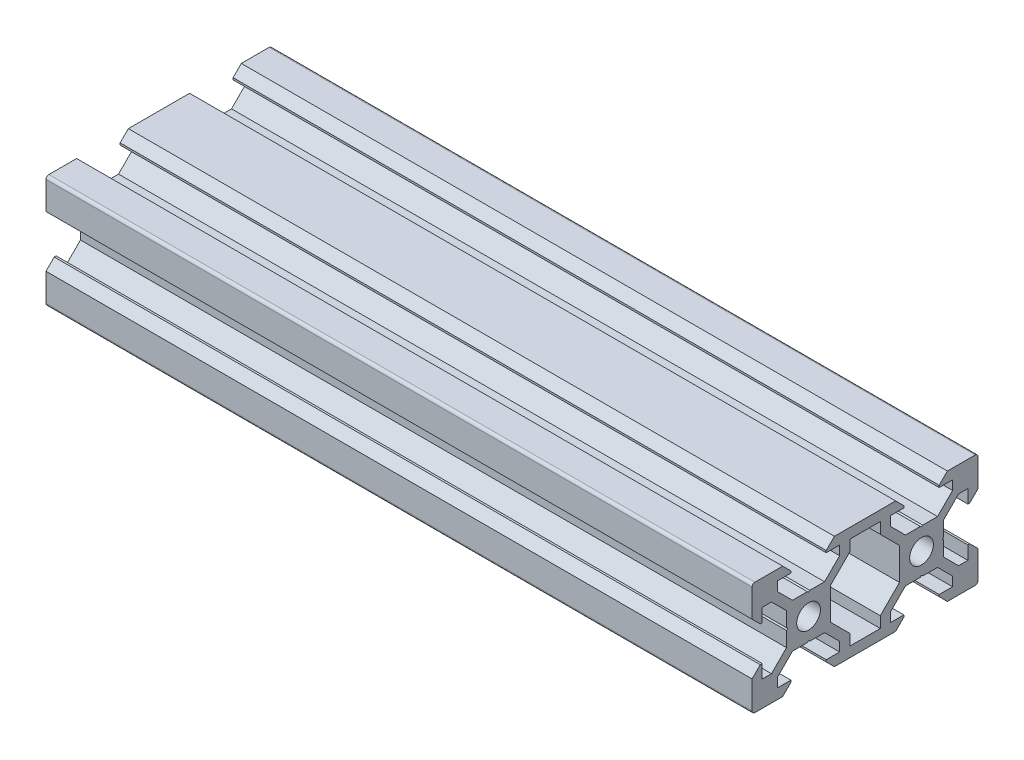
from build123d import *

# Parameters (mm, degrees)
PROFILE_SKETCH_R      = 2.1
PROFILE_EXTRUDE_DEPTH = 125


with BuildPart() as part:
    # Profile Sketch → Profile Extrude (new body)
    with BuildSketch(Plane(origin=(0, 0, 0), x_dir=(0, 0, -1), z_dir=(1, 0, 0))):
        with BuildLine():
            Line((6.875, 8.545), (5.42, 10))
            Line((5.42, 10), (-5.42, 10))
            Line((-5.42, 10), (-6.875, 8.545))
            Line((-6.875, 8.545), (-6.875, 8.2))
            Line((-6.875, 8.2), (-4.5, 8.2))
            Line((-4.5, 8.2), (-4.5, 6.56))
            Line((-4.5, 6.56), (-7.16, 3.9))
            Line((-7.16, 3.9), (-9.79, 3.9))
            Line((-9.79, 3.9), (-10, 3.69))
            Line((-10, 3.69), (-10.21, 3.9))
            Line((-10.21, 3.9), (-12.84, 3.9))
            Line((-12.84, 3.9), (-15.5, 6.56))
            Line((-15.5, 6.56), (-15.5, 8.2))
            Line((-15.5, 8.2), (-13.125, 8.2))
            Line((-13.125, 8.2), (-13.125, 8.545))
            Line((-13.125, 8.545), (-14.58, 10))
            Line((-14.58, 10), (-19.5, 10))
            ThreePointArc((-19.5, 10), (-19.853553391, 9.853553391), (-20, 9.5))
            Line((-20, 9.5), (-20, 4.58))
            Line((-20, 4.58), (-18.545, 3.125))
            Line((-18.545, 3.125), (-18.2, 3.125))
            Line((-18.2, 3.125), (-18.2, 5.5))
            Line((-18.2, 5.5), (-16.56, 5.5))
            Line((-16.56, 5.5), (-13.9, 2.838679656))
            Line((-13.9, 2.838679656), (-13.9, 0.21))
            Line((-13.9, 0.21), (-13.69, 0))
            Line((-13.69, 0), (-13.9, -0.21))
            Line((-13.9, -0.21), (-13.9, -2.838679656))
            Line((-13.9, -2.838679656), (-16.56, -5.5))
            Line((-16.56, -5.5), (-18.2, -5.5))
            Line((-18.2, -5.5), (-18.2, -3.125))
            Line((-18.2, -3.125), (-18.545, -3.125))
            Line((-18.545, -3.125), (-20, -4.58))
            Line((-20, -4.58), (-20, -9.5))
            ThreePointArc((-20, -9.5), (-19.853553391, -9.853553391), (-19.5, -10))
            Line((-19.5, -10), (-14.58, -10))
            Line((-14.58, -10), (-13.125, -8.545))
            Line((-13.125, -8.545), (-13.125, -8.2))
            Line((-13.125, -8.2), (-15.5, -8.2))
            Line((-15.5, -8.2), (-15.5, -6.56))
            Line((-15.5, -6.56), (-12.84, -3.9))
            Line((-12.84, -3.9), (-10.21, -3.9))
            Line((-10.21, -3.9), (-10, -3.69))
            Line((-10, -3.69), (-9.79, -3.9))
            Line((-9.79, -3.9), (-7.16, -3.9))
            Line((-7.16, -3.9), (-4.5, -6.56))
            Line((-4.5, -6.56), (-4.5, -8.2))
            Line((-4.5, -8.2), (-6.875, -8.2))
            Line((-6.875, -8.2), (-6.875, -8.545))
            Line((-6.875, -8.545), (-5.42, -10))
            Line((-5.42, -10), (5.42, -10))
            Line((5.42, -10), (6.875, -8.545))
            Line((6.875, -8.545), (6.875, -8.2))
            Line((6.875, -8.2), (4.5, -8.2))
            Line((4.5, -8.2), (4.5, -6.56))
            Line((4.5, -6.56), (7.16, -3.9))
            Line((7.16, -3.9), (9.79, -3.9))
            Line((9.79, -3.9), (10, -3.69))
            Line((10, -3.69), (10.21, -3.9))
            Line((10.21, -3.9), (12.84, -3.9))
            Line((12.84, -3.9), (15.5, -6.56))
            Line((15.5, -6.56), (15.5, -8.2))
            Line((15.5, -8.2), (13.125, -8.2))
            Line((13.125, -8.2), (13.125, -8.545))
            Line((13.125, -8.545), (14.58, -10))
            Line((14.58, -10), (19.5, -10))
            ThreePointArc((19.5, -10), (19.853553391, -9.853553391), (20, -9.5))
            Line((20, -9.5), (20, -4.58))
            Line((20, -4.58), (18.545, -3.125))
            Line((18.545, -3.125), (18.2, -3.125))
            Line((18.2, -3.125), (18.2, -5.5))
            Line((18.2, -5.5), (16.56, -5.5))
            Line((16.56, -5.5), (13.9, -2.838679656))
            Line((13.9, -2.838679656), (13.9, -0.21))
            Line((13.9, -0.21), (13.69, 0))
            Line((13.69, 0), (13.9, 0.21))
            Line((13.9, 0.21), (13.9, 2.838679656))
            Line((13.9, 2.838679656), (16.56, 5.5))
            Line((16.56, 5.5), (18.2, 5.5))
            Line((18.2, 5.5), (18.2, 3.125))
            Line((18.2, 3.125), (18.545, 3.125))
            Line((18.545, 3.125), (20, 4.58))
            Line((20, 4.58), (20, 9.5))
            ThreePointArc((20, 9.5), (19.853553391, 9.853553391), (19.5, 10))
            Line((19.5, 10), (14.58, 10))
            Line((14.58, 10), (13.125, 8.545))
            Line((13.125, 8.545), (13.125, 8.2))
            Line((13.125, 8.2), (15.5, 8.2))
            Line((15.5, 8.2), (15.5, 6.56))
            Line((15.5, 6.56), (12.84, 3.9))
            Line((12.84, 3.9), (10.21, 3.9))
            Line((10.21, 3.9), (10, 3.69))
            Line((10, 3.69), (9.79, 3.9))
            Line((9.79, 3.9), (7.16, 3.9))
            Line((7.16, 3.9), (4.5, 6.56))
            Line((4.5, 6.56), (4.5, 8.2))
            Line((4.5, 8.2), (6.875, 8.2))
            Line((6.875, 8.2), (6.875, 8.545))
        make_face()
        with Locations((-10, 0)):
            Circle(PROFILE_SKETCH_R, mode=Mode.SUBTRACT)
        with Locations((10, 0)):
            Circle(PROFILE_SKETCH_R, mode=Mode.SUBTRACT)
        Polygon((-2.7, 8.2), (2.7, 8.2), (2.7, 6.238679656), (6.1, 2.838679656), (6.1, -0.21), (6.1, -2.838679656), (2.7, -6.238679656), (2.7, -8.2), (-2.7, -8.2), (-2.7, -6.238679656), (-6.1, -2.838679656), (-6.1, -0.21), (-6.1, 2.838679656), (-2.7, 6.238679656), align=None, mode=Mode.SUBTRACT)
    extrude(amount=PROFILE_EXTRUDE_DEPTH)


solid = part.part
